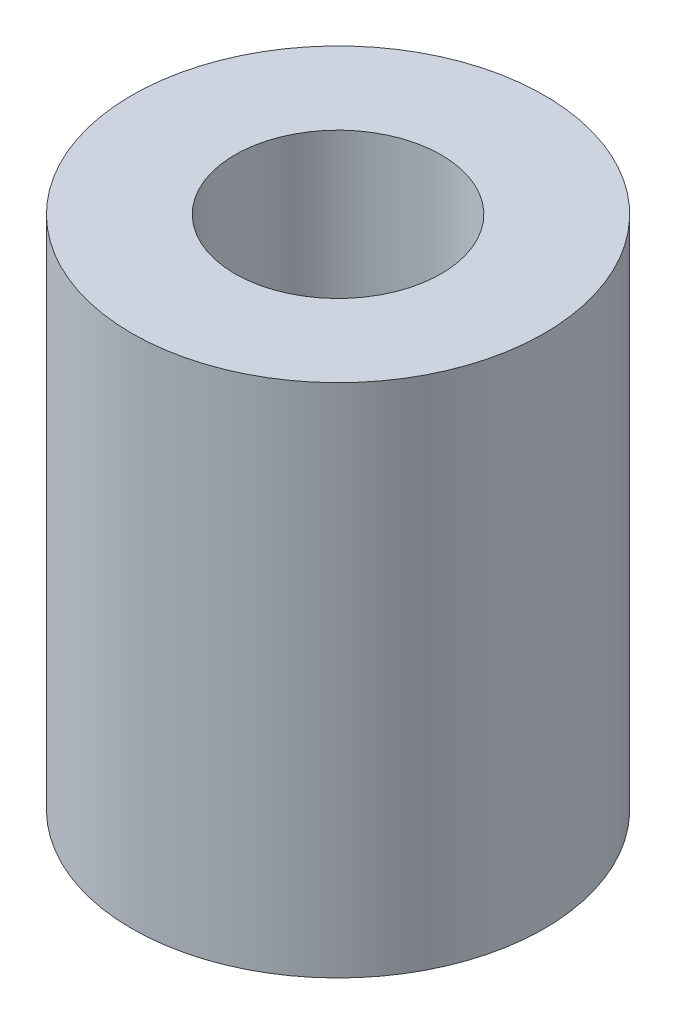
from build123d import *

# Parameters (mm, degrees)
SKETCH_1_R          = 16
EXTRUDE_1_DEPTH     = 40
SKETCH_2_R          = 8
CUT_EXTRUDE_1_DEPTH = 20
SKETCH_3_R          = 4
CUT_EXTRUDE_2_DEPTH = 20


with BuildPart() as part:
    # 草图1 → 凸台-拉伸1 (new body)
    with BuildSketch(Plane(origin=(0, 0, 0), x_dir=(1, 0, 0), z_dir=(0, 1, 0))):
        Circle(SKETCH_1_R)
    extrude(amount=EXTRUDE_1_DEPTH)

    # 草图2 → 切除-拉伸1 (cut)
    with BuildSketch(Plane(origin=(0, 40, 0), x_dir=(1, 0, 0), z_dir=(0, 1, 0))):
        Circle(SKETCH_2_R)
    extrude(amount=-CUT_EXTRUDE_1_DEPTH, mode=Mode.SUBTRACT)

    # 草图3 → 切除-拉伸2 (cut)
    with BuildSketch(Plane.XZ):
        Circle(SKETCH_3_R)
    extrude(amount=-CUT_EXTRUDE_2_DEPTH, mode=Mode.SUBTRACT)


solid = part.part
